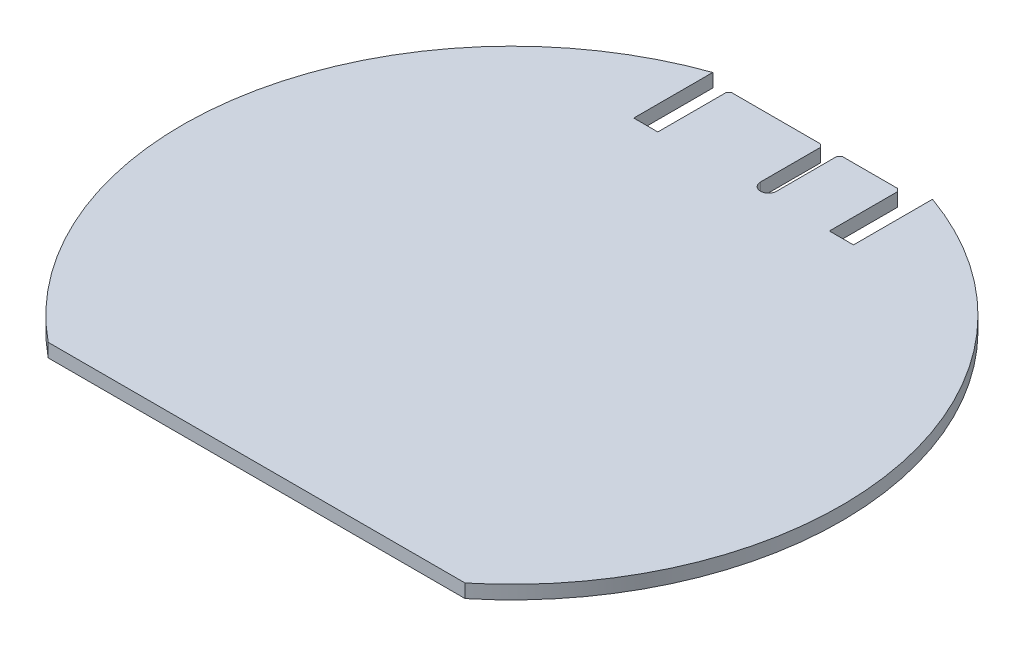
from build123d import *

# Parameters (mm, degrees)
BOSS_EXTRUDE1_DEPTH      = 0.8
BOSS_EXTRUDE1_DEPTH_BACK = 0.8


with BuildPart() as part:
    # Sketch1 → Boss-Extrude1 (new, two sides: drawn at the far end of the back side and taken through both)
    with BuildSketch(Plane(origin=(-28.757656934, 0, -23.069119009), x_dir=(1, 0, 0), z_dir=(0, 1, 0)).offset(-BOSS_EXTRUDE1_DEPTH_BACK)):
        with BuildLine():
            ThreePointArc((15.757656934, 13.700433612), (-9.664026514, -16.377763312), (4.092785152, -53.279119009))
            Line((4.092785152, -53.279119009), (53.422528715, -53.279119009))
            ThreePointArc((53.422528715, -53.279119009), (67.179340381, -16.377763312), (41.757656934, 13.700433612))
            Line((41.757656934, 13.700433612), (41.757656934, 4.348301168))
            Line((41.757656934, 4.348301168), (38.907656934, 4.348301168))
            Line((38.907656934, 4.348301168), (38.907656934, 12.394747778))
            Line((38.907656934, 12.394747778), (38.554103543, 12.748301168))
            Line((38.554103543, 12.748301168), (32.061210324, 12.748301168))
            Line((32.061210324, 12.748301168), (31.707656934, 12.394747778))
            Line((31.707656934, 12.394747778), (31.707656934, 5.289135329))
            ThreePointArc((31.707656934, 5.289135329), (30.757656934, 4.348301168), (29.807656934, 5.289135329))
            Line((29.807656934, 5.289135329), (29.807656934, 12.394747778))
            Line((29.807656934, 12.394747778), (29.454103543, 12.748301168))
            Line((29.454103543, 12.748301168), (18.961210324, 12.748301168))
            Line((18.961210324, 12.748301168), (18.607656934, 12.394747778))
            Line((18.607656934, 12.394747778), (18.607656934, 4.348301168))
            Line((18.607656934, 4.348301168), (15.757656934, 4.348301168))
            Line((15.757656934, 4.348301168), (15.757656934, 13.700433612))
        make_face()
    extrude(amount=BOSS_EXTRUDE1_DEPTH + BOSS_EXTRUDE1_DEPTH_BACK)


solid = part.part
